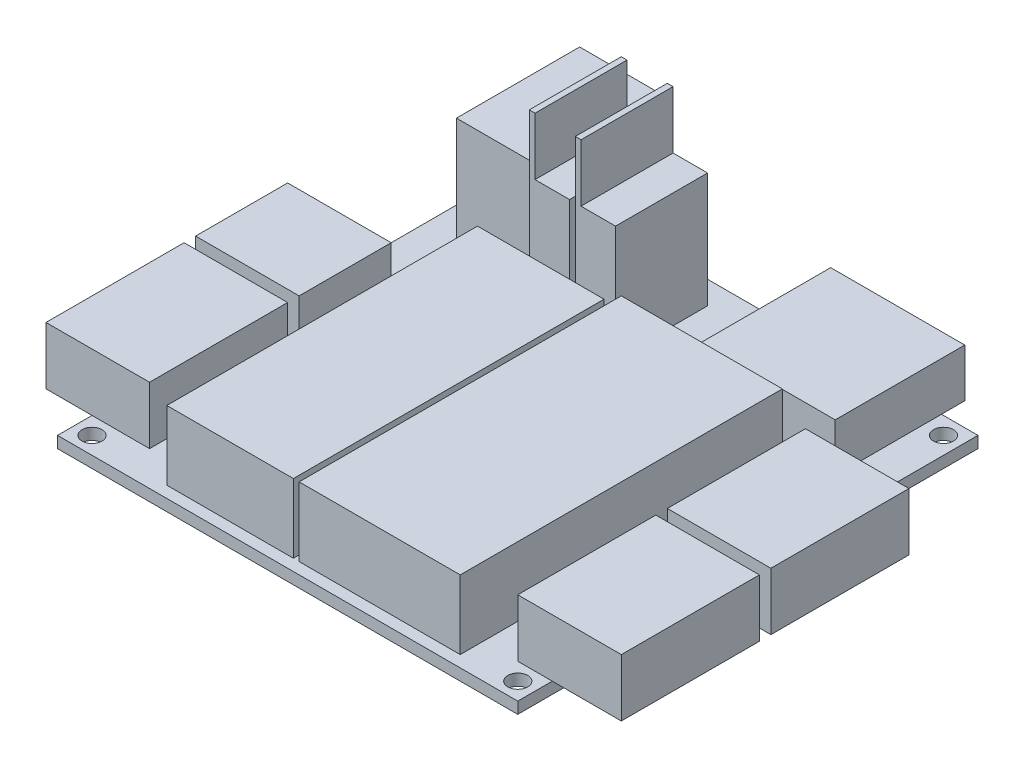
from build123d import *

# Parameters (mm, degrees)
SKETCH3_W           = 50.8
SKETCH3_H           = 50.8
BOSS_EXTRUDE1_DEPTH = 1.27
CUT_EXTRUDE1_REACH  = 73.853
SKETCH4_R           = 1.0999978
SKETCH5_W           = 17.78
SKETCH5_H           = 35.56
SKETCH5_W_2         = 13.97
SKETCH5_H_2         = 34.29
BOSS_EXTRUDE2_DEPTH = 7.62
SKETCH6_W           = 14.8000212
SKETCH6_H           = 14.2999968
BOSS_EXTRUDE3_DEPTH = 5.334
BOSS_EXTRUDE4_DEPTH = 12.7
SKETCH8_W           = 11.43
SKETCH8_H           = 15.24
SKETCH8_H_2         = 10.16
BOSS_EXTRUDE5_DEPTH = 6.35
SKETCH9_W           = 3.81
SKETCH9_H           = 10.16
BOSS_EXTRUDE6_DEPTH = 12.7
SKETCH10_W          = 0.635
SKETCH10_H          = 10.16
BOSS_EXTRUDE7_DEPTH = 19.05


with BuildPart() as part:
    # Sketch3 → Boss-Extrude1 (new body)
    with BuildSketch(Plane(origin=(0, 0, 0), x_dir=(1, 0, 0), z_dir=(0, 1, 0))):
        with Locations((25.4, 25.4)):
            Rectangle(SKETCH3_W, SKETCH3_H)
    extrude(amount=BOSS_EXTRUDE1_DEPTH)

    # Sketch4 → Cut-Extrude1 (cut, up to next)
    with BuildSketch(Plane(origin=(0, 0, 0), x_dir=(1, 0, 0), z_dir=(0, 1, 0)), mode=Mode.PRIVATE) as cut_extrude1_sk1:
        with Locations((1.905, 48.895)):
            Circle(SKETCH4_R)
    cut_extrude1_tool1 = extrude(cut_extrude1_sk1.sketch, amount=CUT_EXTRUDE1_REACH, mode=Mode.PRIVATE) & part.part
    # Sketch4 → Cut-Extrude1 (cut, up to next)
    with BuildSketch(Plane(origin=(0, 0, 0), x_dir=(1, 0, 0), z_dir=(0, 1, 0)), mode=Mode.PRIVATE) as cut_extrude1_sk2:
        with Locations((48.895, 48.895)):
            Circle(SKETCH4_R)
    cut_extrude1_tool2 = extrude(cut_extrude1_sk2.sketch, amount=CUT_EXTRUDE1_REACH, mode=Mode.PRIVATE) & part.part
    # Sketch4 → Cut-Extrude1 (cut, up to next)
    with BuildSketch(Plane(origin=(0, 0, 0), x_dir=(1, 0, 0), z_dir=(0, 1, 0)), mode=Mode.PRIVATE) as cut_extrude1_sk3:
        with Locations((48.895, 1.905)):
            Circle(SKETCH4_R)
    cut_extrude1_tool3 = extrude(cut_extrude1_sk3.sketch, amount=CUT_EXTRUDE1_REACH, mode=Mode.PRIVATE) & part.part
    # Sketch4 → Cut-Extrude1 (cut, up to next)
    with BuildSketch(Plane(origin=(0, 0, 0), x_dir=(1, 0, 0), z_dir=(0, 1, 0)), mode=Mode.PRIVATE) as cut_extrude1_sk4:
        with Locations((1.905, 1.905)):
            Circle(SKETCH4_R)
    cut_extrude1_tool4 = extrude(cut_extrude1_sk4.sketch, amount=CUT_EXTRUDE1_REACH, mode=Mode.PRIVATE) & part.part
    add(cut_extrude1_tool1.solids().sort_by_distance((1.905, 0, -48.895))[0], mode=Mode.SUBTRACT)
    add(cut_extrude1_tool2.solids().sort_by_distance((48.895, 0, -48.895))[0], mode=Mode.SUBTRACT)
    add(cut_extrude1_tool3.solids().sort_by_distance((48.895, 0, -1.905))[0], mode=Mode.SUBTRACT)
    add(cut_extrude1_tool4.solids().sort_by_distance((1.905, 0, -1.905))[0], mode=Mode.SUBTRACT)

    # Sketch5 → Boss-Extrude2 (add)
    with BuildSketch(Plane(origin=(0, 1.27, 0), x_dir=(1, 0, 0), z_dir=(0, 1, 0))):
        with Locations((34.29, 19.05)):
            Rectangle(SKETCH5_W, SKETCH5_H)
        with Locations((17.78, 18.415)):
            Rectangle(SKETCH5_W_2, SKETCH5_H_2)
    extrude(amount=BOSS_EXTRUDE2_DEPTH)

    # Sketch6 → Boss-Extrude3 (add)
    with BuildSketch(Plane(origin=(0, 1.27, 0), x_dir=(1, 0, 0), z_dir=(0, 1, 0))):
        with Locations((39.37, 46.219999)):
            Rectangle(SKETCH6_W, SKETCH6_H)
    extrude(amount=BOSS_EXTRUDE3_DEPTH)

    # Sketch7 → Boss-Extrude4 (add)
    with BuildSketch(Plane(origin=(0, 1.27, 0), x_dir=(1, 0, 0), z_dir=(0, 1, 0))):
        Polygon((4.390009, 53.2400002), (13.389991, 53.2400002), (13.389991, 50.340006), (13.389991, 39.640002), (4.390009, 39.640002), align=None)
    extrude(amount=BOSS_EXTRUDE4_DEPTH)

    # Sketch8 → Boss-Extrude5 (add)
    with BuildSketch(Plane(origin=(0, 1.27, 0), x_dir=(1, 0, 0), z_dir=(0, 1, 0))):
        with Locations((0.635, 11.43)):
            Rectangle(SKETCH8_W, SKETCH8_H)
        with Locations((0.635, 25.4)):
            Rectangle(SKETCH8_W, SKETCH8_H_2)
        with Locations((52.705, 27.94)):
            Rectangle(SKETCH8_W, SKETCH8_H)
        with Locations((52.705, 11.43)):
            Rectangle(SKETCH8_W, SKETCH8_H)
    extrude(amount=BOSS_EXTRUDE5_DEPTH)

    # Sketch9 → Boss-Extrude6 (add)
    with BuildSketch(Plane(origin=(0, 1.27, 0), x_dir=(1, 0, 0), z_dir=(0, 1, 0))):
        with Locations((21.59, 43.18)):
            Rectangle(SKETCH9_W, SKETCH9_H)
        with Locations((16.51, 43.18)):
            Rectangle(SKETCH9_W, SKETCH9_H)
    extrude(amount=BOSS_EXTRUDE6_DEPTH)

    # Sketch10 → Boss-Extrude7 (add)
    with BuildSketch(Plane(origin=(0, 1.27, 0), x_dir=(1, 0, 0), z_dir=(0, 1, 0))):
        with Locations((19.3675, 43.18)):
            Rectangle(SKETCH10_W, SKETCH10_H)
        with Locations((14.2875, 43.18)):
            Rectangle(SKETCH10_W, SKETCH10_H)
    extrude(amount=BOSS_EXTRUDE7_DEPTH)


solid = part.part
